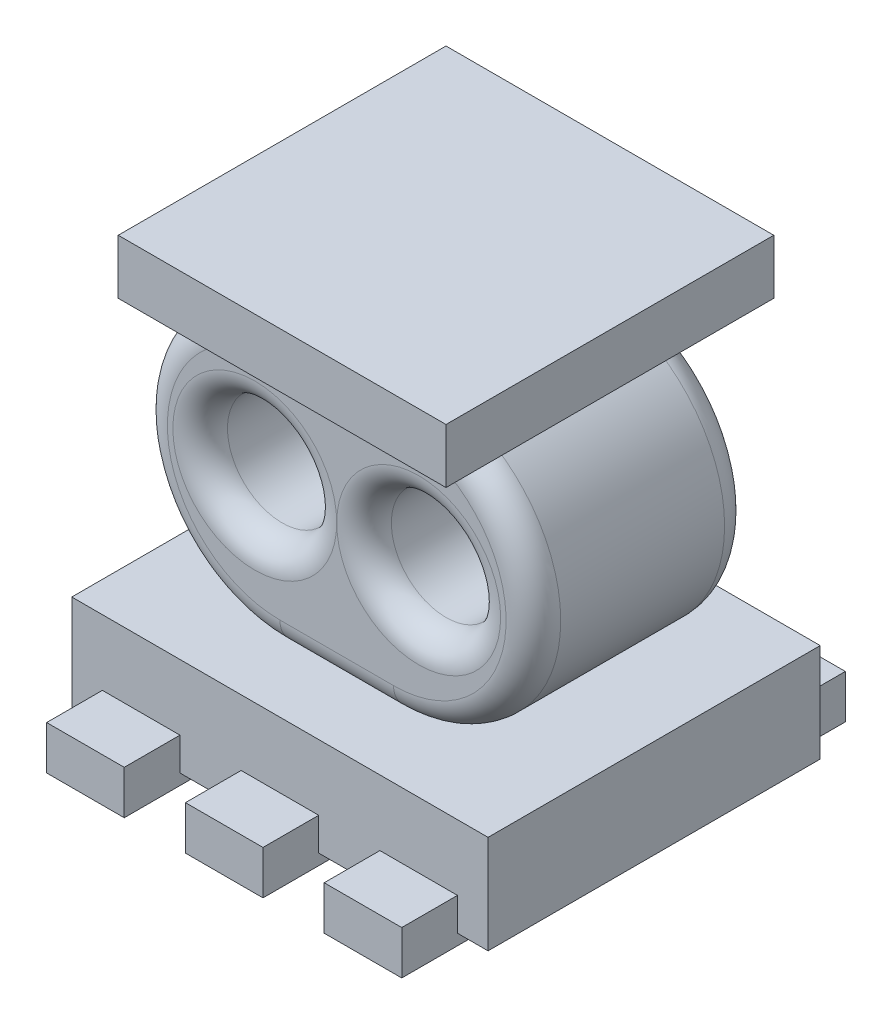
from build123d import *

# Parameters (mm, degrees)
SKETCH_1_W           = 3.81
SKETCH_1_H           = 3.04
EXTRUDE_1_DEPTH      = 0.9
EXTRUDE_2_DEPTH      = 0.3
EXTRUDE_2_DEPTH_BACK = 0.1
SKETCH_2_W           = 0.71
SKETCH_2_H           = 1.02
SKETCH_3_R           = 0.5
EXTRUDE_3_DEPTH      = 1
EXTRUDE_4_DEPTH      = 1.5
FILLET_2_R           = 0.25


with BuildPart() as part:
    # Эскиз1 → Бобышка-Вытянуть1 (new body)
    with BuildSketch(Plane(origin=(0, 0, 0), x_dir=(1, 0, 0), z_dir=(0, 1, 0))):
        Rectangle(SKETCH_1_W, SKETCH_1_H)
    extrude(amount=EXTRUDE_1_DEPTH)

    # Эскиз2 → Бобышка-Вытянуть2 (add, two sides: drawn at the far end of the back side and taken through both)
    with BuildSketch(Plane(origin=(0, 0, 0), x_dir=(1, 0, 0), z_dir=(0, 1, 0)).offset(-EXTRUDE_2_DEPTH_BACK)):
        with Locations((1.27, -1.52)):
            Rectangle(SKETCH_2_W, SKETCH_2_H)
        with Locations((0, -1.52)):
            Rectangle(SKETCH_2_W, SKETCH_2_H)
        with Locations((-1.27, -1.52)):
            Rectangle(SKETCH_2_W, SKETCH_2_H)
        with Locations((-1.27, 1.52)):
            Rectangle(SKETCH_2_W, SKETCH_2_H)
        with Locations((0, 1.52)):
            Rectangle(SKETCH_2_W, SKETCH_2_H)
        with Locations((1.27, 1.52)):
            Rectangle(SKETCH_2_W, SKETCH_2_H)
    extrude(amount=EXTRUDE_2_DEPTH + EXTRUDE_2_DEPTH_BACK)


with BuildPart() as body_2:
    # Эскиз3 → Бобышка-Вытянуть3 (new, symmetric)
    with BuildSketch(Plane.XY):
        with BuildLine():
            Line((0.52, 3.46), (-0.52, 3.46))
            ThreePointArc((-0.52, 3.46), (-1.8, 2.18), (-0.52, 0.9))
            Line((-0.52, 0.9), (0.52, 0.9))
            ThreePointArc((0.52, 0.9), (1.8, 2.18), (0.52, 3.46))
        make_face()
        with Locations((-0.75, 2.18)):
            Circle(SKETCH_3_R, mode=Mode.SUBTRACT)
        with Locations((0.75, 2.18)):
            Circle(SKETCH_3_R, mode=Mode.SUBTRACT)
    extrude(amount=EXTRUDE_3_DEPTH, both=True)

    # Скругление2
    fillet_2_edges = [body_2.edges().sort_by_distance(p)[0] for p in [
        (0, 0.9, 1),
        (1.8, 2.18, -1),
        (0, 3.46, -1),
        (-1.8, 2.18, -1),
        (0.25, 2.18, -1),
        (-1.25, 2.18, -1),
        (0, 0.9, -1),
        (-1.25, 2.18, 1),
        (0.25, 2.18, 1),
        (-1.8, 2.18, 1),
        (0, 3.46, 1),
        (1.8, 2.18, 1),
    ]]
    fillet(fillet_2_edges, radius=FILLET_2_R - 0.0001)  # a hair under: the kernel refuses the full size


with BuildPart() as body_3:
    # Эскиз3<3> → Бобышка-Вытянуть4 (new, symmetric)
    with BuildSketch(Plane.XY):
        Polygon((-1.5, 3.46), (-0.52, 3.46), (0.52, 3.46), (1.5, 3.46), (1.5, 3.96), (-1.5, 3.96), align=None)
    extrude(amount=EXTRUDE_4_DEPTH, both=True)


with BuildPart() as part_1:
    add(part.part)

    # Combine 1: union body 2, body 3
    add(body_2.part)
    add(body_3.part)


solid = part_1.part
